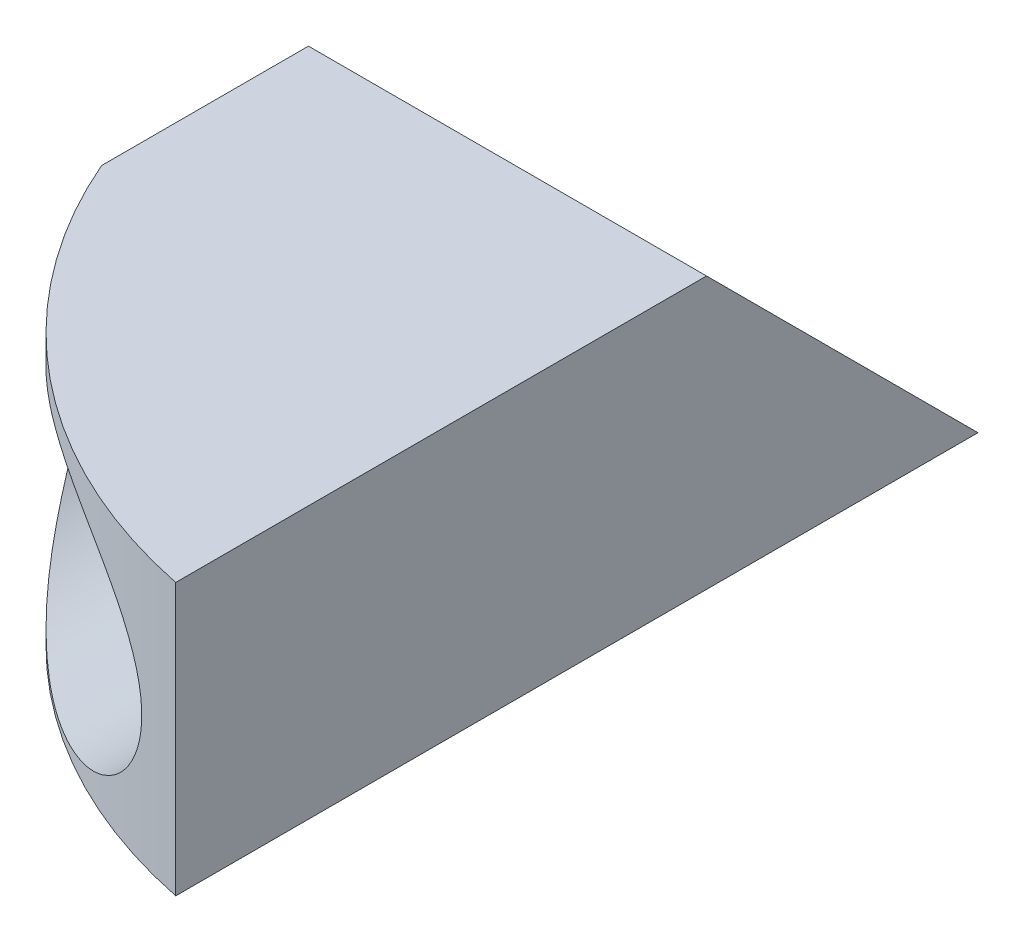
from build123d import *

# Parameters (mm, degrees)
BOSS_EXTRUDE2_DEPTH = 44
SKETCH3_R           = 19
CUT_EXTRUDE1_DEPTH  = 119.193668477
SKETCH4_OUTSIDE_W   = 68.66
SKETCH4_OUTSIDE_H   = 124.66
SKETCH4_OUTSIDE_R   = 61.301428863
CUT_EXTRUDE3_DEPTH  = 114.296072371


with BuildPart() as part:
    # Sketch2 → Boss-Extrude2 (new body)
    with BuildSketch(Plane(origin=(0, 0, 0), x_dir=(0, 0, -1), z_dir=(1, 0, 0))):
        Polygon((100, 0), (70, 30), (0, 30), (0, 0), align=None)
    extrude(amount=BOSS_EXTRUDE2_DEPTH)

    # Sketch3 → Cut-Extrude1 (cut, through all, along a direction that is not the sketch's normal)
    with BuildSketch(Plane(origin=(0, 50, -50), x_dir=(1, 0, 0), z_dir=(0, 0.7071067811865513, -0.7071067811865437))):
        with Locations((20.000000298, 50.710677821)):
            Circle(SKETCH3_R)
    extrude(amount=-CUT_EXTRUDE1_DEPTH, dir=(0, 0, -1), mode=Mode.SUBTRACT)

    # Sketch4 outside → Cut-Extrude3 (cut, through all)
    with BuildSketch(Plane(origin=(0, 30, 0), x_dir=(1, 0, 0), z_dir=(0, 1, 0))):
        with Locations((22, 50)):
            Rectangle(SKETCH4_OUTSIDE_W, SKETCH4_OUTSIDE_H)
        with Locations((56.3, 71.388360854)):
            Circle(SKETCH4_OUTSIDE_R, mode=Mode.SUBTRACT)
    extrude(amount=-CUT_EXTRUDE3_DEPTH, mode=Mode.SUBTRACT)


solid = part.part
